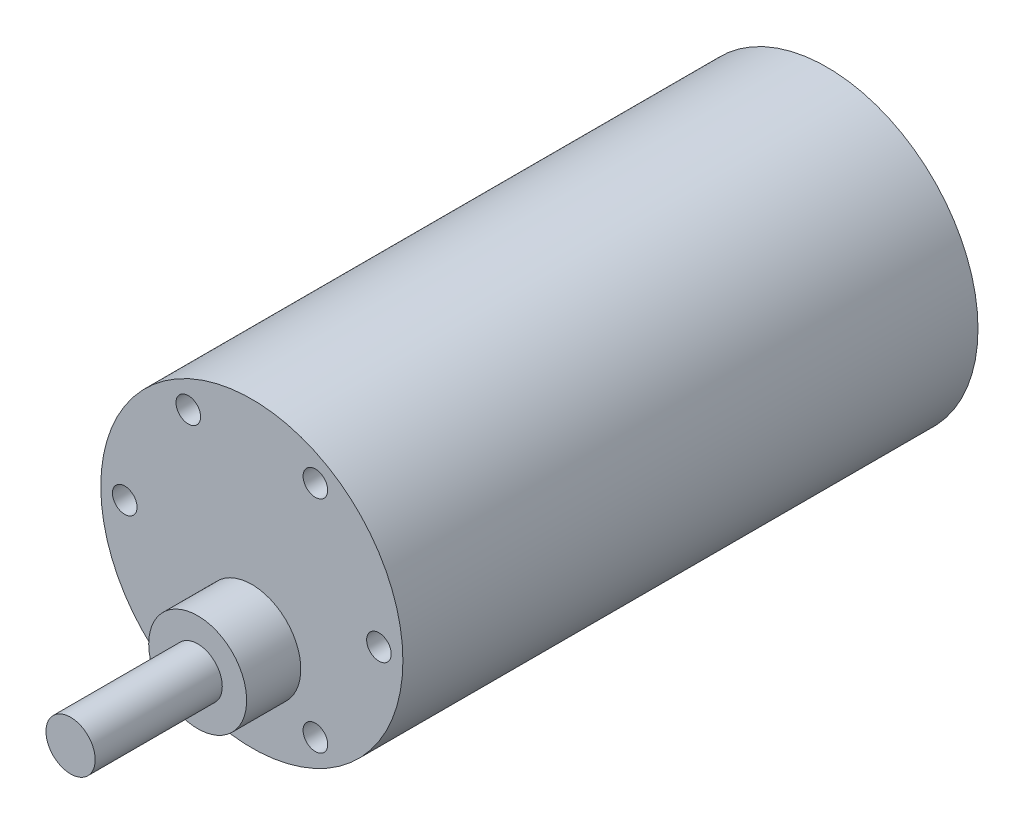
from build123d import *

# Parameters (mm, degrees)
SKETCH1_R           = 18.415
BOSS_EXTRUDE1_DEPTH = 70.104
SKETCH2_R           = 5.969
BOSS_EXTRUDE2_DEPTH = 6.604
SKETCH3_R           = 3
BOSS_EXTRUDE3_DEPTH = 15.494
SKETCH4_R           = 1.5
CUT_EXTRUDE1_DEPTH  = 25.4


with BuildPart() as part:
    # Sketch1 → Boss-Extrude1 (new body)
    with BuildSketch(Plane.XY):
        Circle(SKETCH1_R)
    extrude(amount=BOSS_EXTRUDE1_DEPTH)

    # Sketch2 → Boss-Extrude2 (add)
    with BuildSketch(Plane.XY.offset(70.104)):
        with Locations((0, -7.112)):
            Circle(SKETCH2_R)
    extrude(amount=BOSS_EXTRUDE2_DEPTH)

    # Sketch3 → Boss-Extrude3 (add)
    with BuildSketch(Plane.XY.offset(76.708)):
        with Locations((0, -7.112)):
            Circle(SKETCH3_R)
    extrude(amount=BOSS_EXTRUDE3_DEPTH)

    # Sketch4 → Cut-Extrude1 (cut)
    with BuildSketch(Plane.XY.offset(70.104)):
        with Locations((-15.494, 0)):
            Circle(SKETCH4_R)
        with Locations((15.494, 0)):
            Circle(SKETCH4_R)
        with Locations((7.747, 13.418197606)):
            Circle(SKETCH4_R)
        with Locations((-7.747, 13.418197606)):
            Circle(SKETCH4_R)
        with Locations((-7.747, -13.418197606)):
            Circle(SKETCH4_R)
        with Locations((7.747, -13.418197606)):
            Circle(SKETCH4_R)
    extrude(amount=-CUT_EXTRUDE1_DEPTH, mode=Mode.SUBTRACT)


solid = part.part
